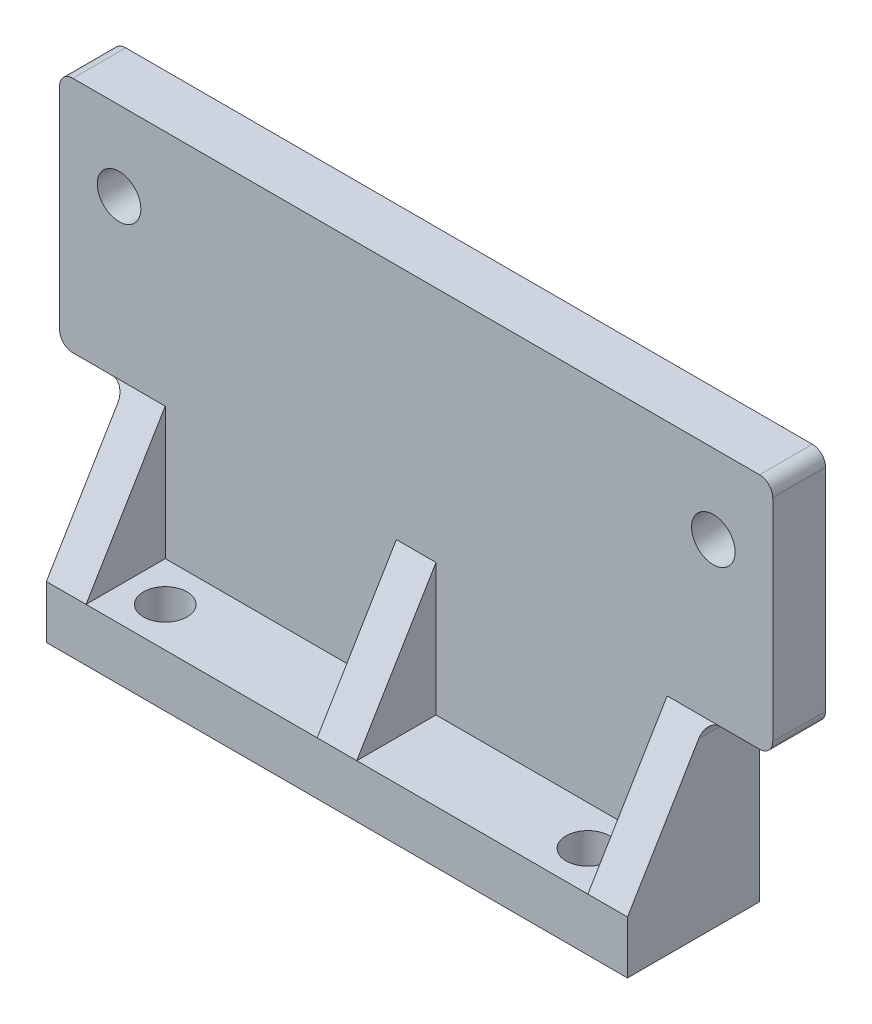
from build123d import *

# Parameters (mm, degrees)
SKETCH1_W           = 44
SKETCH1_H           = 10
SKETCH1_R           = 1.65
BOSS_EXTRUDE1_DEPTH = 4
SKETCH2_W           = 44
SKETCH2_H           = 4
BOSS_EXTRUDE2_DEPTH = 28
RIB6_REACH          = 57.317
SKETCH5_WALL_W      = 124.296437278
SKETCH5_WALL_H      = 3
LPATTERN1_COUNT     = 3
LPATTERN1_PITCH     = 20.5
SKETCH7_W           = 4
SKETCH7_H           = 18
BOSS_EXTRUDE3_DEPTH = 5
SKETCH8_W           = 4
SKETCH8_H           = 18
BOSS_EXTRUDE4_DEPTH = 5
FILLET1_R           = 1
SKETCH9_R           = 1.65
CUT_EXTRUDE1_DEPTH  = 59.83026432


with BuildPart() as part:
    # Sketch1 → Boss-Extrude1 (new body)
    with BuildSketch(Plane(origin=(0, 0, 0), x_dir=(1, 0, 0), z_dir=(0, 1, 0))):
        with Locations((22, 5)):
            Rectangle(SKETCH1_W, SKETCH1_H)
        with Locations((38, 3)):
            Circle(SKETCH1_R, mode=Mode.SUBTRACT)
        with Locations((6, 3)):
            Circle(SKETCH1_R, mode=Mode.SUBTRACT)
    extrude(amount=BOSS_EXTRUDE1_DEPTH)

    # Sketch2 → Boss-Extrude2 (add)
    with BuildSketch(Plane(origin=(0, 4, 0), x_dir=(1, 0, 0), z_dir=(0, 1, 0))):
        with Locations((22, 8)):
            Rectangle(SKETCH2_W, SKETCH2_H)
    extrude(amount=BOSS_EXTRUDE2_DEPTH)

    # Sketch5 wall → Rib6 (add, up to next)
    with BuildSketch(Plane(origin=(44, 9, -3), x_dir=(0, -0.857492925713, 0.514495755428), z_dir=(0, -0.514495755428, -0.857492925713)), mode=Mode.PRIVATE) as rib6_sk1:
        with Locations((0, 1.5)):
            Rectangle(SKETCH5_WALL_W, SKETCH5_WALL_H)
    rib6_tool1 = extrude(rib6_sk1.sketch, amount=RIB6_REACH, mode=Mode.PRIVATE) - part.part
    rib6 = rib6_tool1.solids().sort_by_distance((44, 9, -3))[0]
    add(rib6)

    # LPattern1: Rib6 ×3
    with Locations(*[(-i * LPATTERN1_PITCH, 0, 0) for i in range(1, LPATTERN1_COUNT)]):
        add(rib6)

    # Sketch7 → Boss-Extrude3 (add)
    with BuildSketch(Plane(origin=(44, 0, 0), x_dir=(0, 0, -1), z_dir=(1, 0, 0))):
        with Locations((8, 23)):
            Rectangle(SKETCH7_W, SKETCH7_H)
    extrude(amount=BOSS_EXTRUDE3_DEPTH)

    # Sketch8 → Boss-Extrude4 (add)
    with BuildSketch(Plane.ZY):
        with Locations((-8, 23)):
            Rectangle(SKETCH8_W, SKETCH8_H)
    extrude(amount=BOSS_EXTRUDE4_DEPTH)

    # Fillet1
    fillet1_edges = [part.edges().sort_by_distance(p)[0] for p in [
        (44, 14, -8),
        (49, 14, -8),
        (49, 32, -8),
        (-5, 32, -8),
        (-5, 14, -8),
        (0, 14, -8),
    ]]
    fillet(fillet1_edges, radius=FILLET1_R)

    # Sketch9 → Cut-Extrude1 (cut, through all)
    with BuildSketch(Plane.XY.offset(-6)):
        with Locations((-0.5, 26)):
            Circle(SKETCH9_R)
        with Locations((44.5, 26)):
            Circle(SKETCH9_R)
    extrude(amount=-CUT_EXTRUDE1_DEPTH, mode=Mode.SUBTRACT)


solid = part.part
